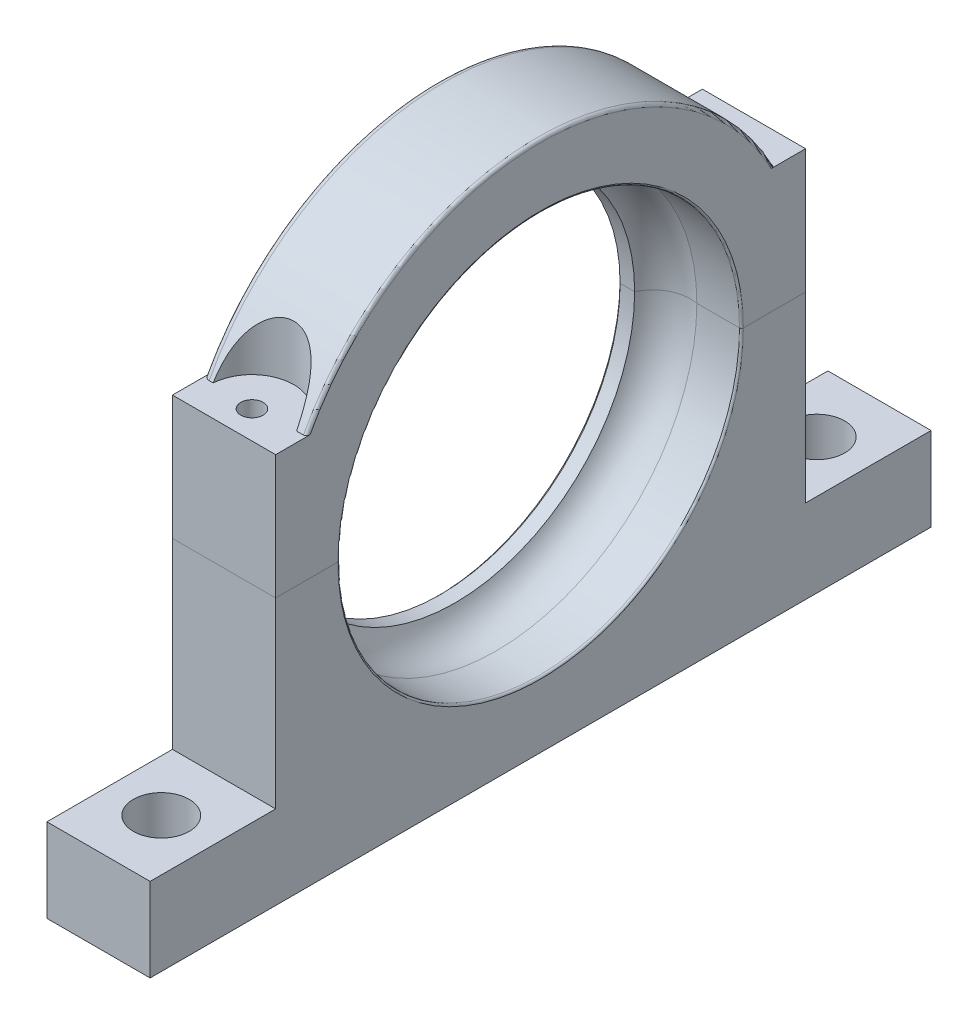
from build123d import *

# Parameters (mm, degrees)
BOSS_EXTRU_2_DEPTH           = 37
ESQUISSE4_R                  = 15
ENL_V_MAT_EXTRU_1_DEPTH      = 37
ESQUISSE6_R                  = 4
ENL_V_MAT_EXTRU_2_DEPTH      = 100
ESQUISSE7_R                  = 10
ENL_V_MAT_EXTRU_3_DEPTH      = 217.169494105
FRACTIONNER2_SURFACE_1_BACK  = 341.675
FRACTIONNER2_SURFACE_1_DEPTH = 683.35
FRACTIONNER2_SURFACE_2_BACK  = 341.675
FRACTIONNER2_SURFACE_2_DEPTH = 683.35


with BuildPart() as part:
    # Esquisse1 → Révolution1 (revolve)
    with BuildSketch(Plane.XY):
        with BuildLine():
            Line((0, 92.899985), (0, 65.5))
            Line((0, 65.5), (1.05, 64.45))
            Line((1.05, 64.45), (6.268972406, 64.45))
            ThreePointArc((6.268972406, 64.45), (12.33952319, 70.755688713), (21.002086329, 72.01))
            Line((21.002086329, 72.01), (36.3, 72.01))
            ThreePointArc((36.3, 72.01), (36.794969719, 72.215020225), (37, 72.709985779))
            Line((37, 72.709985779), (37, 93.899984804))
            ThreePointArc((37, 93.899984804), (36.677822915, 94.67781224), (35.9, 95.000000237))
            Line((35.9, 95.000000237), (2.1, 95.000000237))
            ThreePointArc((2.1, 95.000000237), (0.615070373, 94.38491909), (0, 92.899985))
        make_face()
    revolve(axis=Axis((-0.001288092, 0, 0), (1, 0, 0)))

    # Esquisse2 → Boss.-Extru.2 (add)
    with BuildSketch(Plane.ZY):
        with BuildLine():
            Line((-95.000000237, 44.5), (-95.000000237, -65.5))
            Line((-95.000000237, -65.5), (-140.000000237, -65.5))
            Line((-140.000000237, -65.5), (-140.000000237, -95.5))
            Line((-140.000000237, -95.5), (140.000000237, -95.5))
            Line((140.000000237, -95.5), (140.000000237, -65.5))
            Line((140.000000237, -65.5), (95.000000237, -65.5))
            Line((95.000000237, -65.5), (95.000000237, 44.5))
            Line((95.000000237, 44.5), (81.548496081, 44.5))
            ThreePointArc((81.548496081, 44.5), (90.017390752, 22.962503678), (92.899985, 0))
            ThreePointArc((92.899985, 0), (0, -92.899985), (-92.899985, 0))
            ThreePointArc((-92.899985, 0), (-90.017390752, 22.962503678), (-81.548496081, 44.5))
            Line((-81.548496081, 44.5), (-95.000000237, 44.5))
        make_face()
    extrude(amount=-BOSS_EXTRU_2_DEPTH)

    # Esquisse4 → Enlèv. mat.-Extru.1 (cut)
    with BuildSketch(Plane(origin=(0, 44.5, 0), x_dir=(1, 0, 0), z_dir=(0, 1, 0))):
        with Locations((18.5, 85.000000237)):
            Circle(ESQUISSE4_R)
    enl_v_mat_extru_1 = extrude(amount=ENL_V_MAT_EXTRU_1_DEPTH, mode=Mode.SUBTRACT)

    # Esquisse6 → Enlèv. mat.-Extru.2 (cut)
    with BuildSketch(Plane(origin=(0, 44.5, 0), x_dir=(1, 0, 0), z_dir=(0, 1, 0))):
        with Locations((18.5, 85.000000237)):
            Circle(ESQUISSE6_R)
    enl_v_mat_extru_2 = extrude(amount=-ENL_V_MAT_EXTRU_2_DEPTH, mode=Mode.SUBTRACT)

    # Esquisse7 → Enlèv. mat.-Extru.3 (cut, through all)
    with BuildSketch(Plane(origin=(0, -65.5, 0), x_dir=(1, 0, 0), z_dir=(0, 1, 0))):
        with Locations((18.5, 117.500000237)):
            Circle(ESQUISSE7_R)
    enl_v_mat_extru_3 = extrude(amount=-ENL_V_MAT_EXTRU_3_DEPTH, mode=Mode.SUBTRACT)

    # Symétrie1: Enlèv. mat.-Extru.1, Enlèv. mat.-Extru.2, Enlèv. mat.-Extru.3 across plane
    add(enl_v_mat_extru_1.mirror(Plane.XY), mode=Mode.SUBTRACT)
    add(enl_v_mat_extru_2.mirror(Plane.XY), mode=Mode.SUBTRACT)
    add(enl_v_mat_extru_3.mirror(Plane.XY), mode=Mode.SUBTRACT)


with BuildPart() as body_2:
    # Fractionner2: the piece behind the surface
    add(part.part)
    # Fractionner2 surface: a surface, the sketch's curves swept straight by 683.35 mm
    with BuildLine(Plane(origin=(37, 0, 0), x_dir=(0, 0, -1), z_dir=(1, 0, 0)).offset(-FRACTIONNER2_SURFACE_1_BACK), mode=Mode.PRIVATE) as fractionner2_surface_1_path:
        Line((-95.000000237, 0), (95.000000237, 0))
    fractionner2_surface_1 = Shell.extrude(fractionner2_surface_1_path.wire(), (1 * FRACTIONNER2_SURFACE_1_DEPTH, 0 * FRACTIONNER2_SURFACE_1_DEPTH, 0 * FRACTIONNER2_SURFACE_1_DEPTH))
    split(bisect_by=fractionner2_surface_1, keep=Keep.BOTTOM)


with BuildPart() as part_1:
    add(part.part)

    # Fractionner2: split by a surface, the side it looks to stays
    # Fractionner2 surface: a surface, the sketch's curves swept straight by 683.35 mm
    with BuildLine(Plane(origin=(37, 0, 0), x_dir=(0, 0, -1), z_dir=(1, 0, 0)).offset(-FRACTIONNER2_SURFACE_2_BACK), mode=Mode.PRIVATE) as fractionner2_surface_2_path:
        Line((-95.000000237, 0), (95.000000237, 0))
    fractionner2_surface_2 = Shell.extrude(fractionner2_surface_2_path.wire(), (1 * FRACTIONNER2_SURFACE_2_DEPTH, 0 * FRACTIONNER2_SURFACE_2_DEPTH, 0 * FRACTIONNER2_SURFACE_2_DEPTH))
    split(bisect_by=fractionner2_surface_2, keep=Keep.TOP)


solid = Compound([body_2.part, part_1.part])
